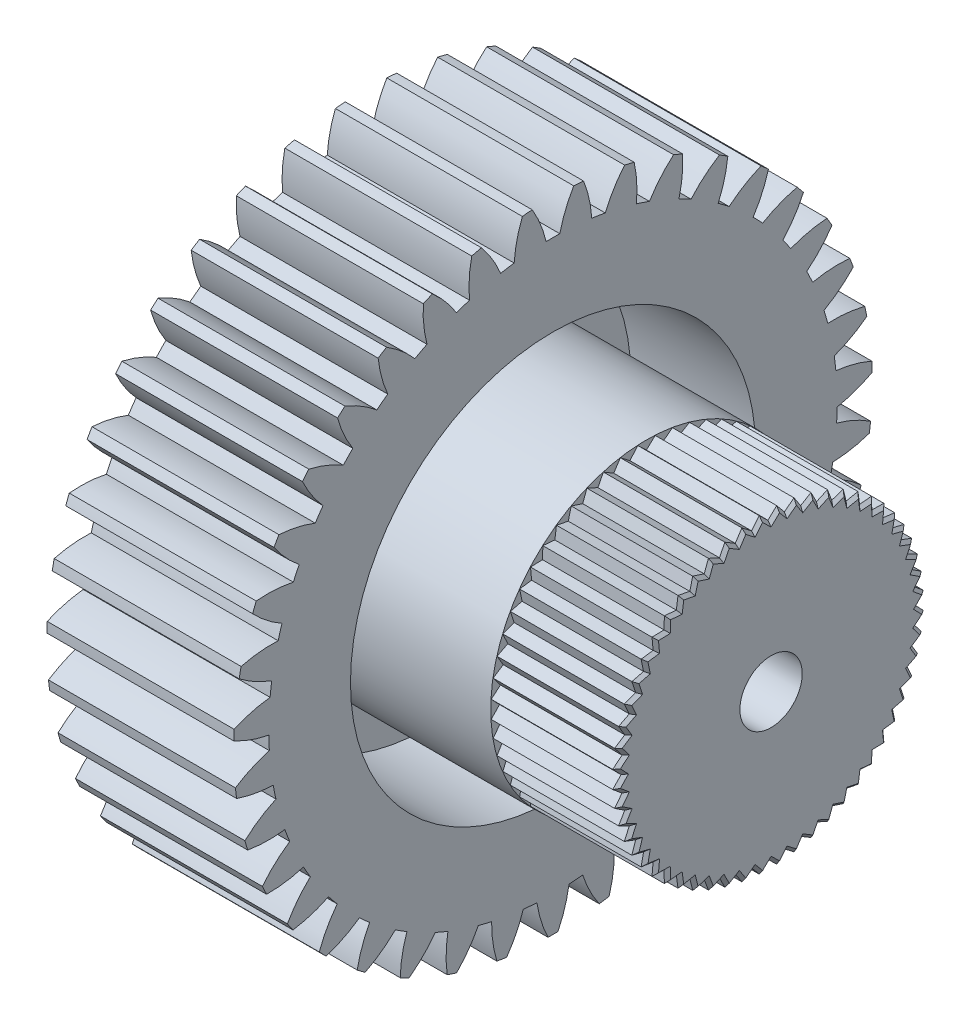
from build123d import *

# Parameters (mm, degrees)
CUT_EXTRUDE1_START         = -3
CUT_EXTRUDE1_OUTLINE_R     = 3.25
CUT_EXTRUDE1_DEPTH         = 3
CUT_EXTRUDE1_2_OUTLINE_R   = 3.25
CUT_EXTRUDE1_2_OUTLINE_R_2 = 0.5
CUT_EXTRUDE1_2_DEPTH       = 1
BOSS_EXTRUDE1_DEPTH        = 3.5
BOSS_EXTRUDE1_DEPTH_BACK   = 2
SKETCH1_3_R                = 2.5
CUT_EXTRUDE2_START         = -2
CUT_EXTRUDE2_DEPTH         = 12.734739324
CIRPATTERN1_COUNT          = 56
CHAMFER1_SIZE              = 0.05
SKETCH3_R                  = 0.5
CUT_EXTRUDE3_DEPTH         = 10.097535364


with BuildPart() as part:
    # Cut-Extrude1: read off the stored shape, not the designer's step
    # Cut-Extrude1 outline → Cut-Extrude1 (new body)
    with BuildSketch(Plane(origin=(3, 0, 0), x_dir=(0, 0, -1), z_dir=(1, 0, 0)).offset(CUT_EXTRUDE1_START)):
        with BuildLine():
            ThreePointArc((-5.117025453, 0.285789287), (-5.120843616, 0.206362943), (-5.123428999, 0.12688692))
            ThreePointArc((-5.123428999, 0.12688692), (-4.849895818, 0.0048664), (-4.560902559, -0.073824801))
            ThreePointArc((-4.560902559, -0.073824801), (-4.557800615, -0.183673086), (-4.552053385, -0.293414769))
            ThreePointArc((-4.552053385, -0.293414769), (-4.833777518, -0.395105094), (-5.096605143, -0.538740217))
            ThreePointArc((-5.096605143, -0.538740217), (-5.08763298, -0.617750486), (-5.077436033, -0.69661204))
            ThreePointArc((-5.077436033, -0.69661204), (-4.787871566, -0.773174619), (-4.489997737, -0.804489011))
            ThreePointArc((-4.489997737, -0.804489011), (-4.469315059, -0.912417202), (-4.446038451, -1.019815839))
            ThreePointArc((-4.446038451, -1.019815839), (-4.707802054, -1.16538103), (-4.944185436, -1.349316631))
            ThreePointArc((-4.944185436, -1.349316631), (-4.922655322, -1.425864503), (-4.89994014, -1.502069115))
            ThreePointArc((-4.89994014, -1.502069115), (-4.601843956, -1.531190821), (-4.302804333, -1.514317378))
            ThreePointArc((-4.302804333, -1.514317378), (-4.265076591, -1.617530192), (-4.224873456, -1.719804214))
            ThreePointArc((-4.224873456, -1.719804214), (-4.45989699, -1.905474209), (-4.663713924, -2.124946454))
            ThreePointArc((-4.663713924, -2.124946454), (-4.630183477, -2.197049377), (-4.595538371, -2.268623388))
            ThreePointArc((-4.595538371, -2.268623388), (-4.296631004, -2.249549986), (-4.004170557, -2.18492572))
            ThreePointArc((-4.004170557, -2.18492572), (-3.950374879, -2.28075), (-3.894286457, -2.375250564))
            ThreePointArc((-3.894286457, -2.375250564), (-4.096482937, -2.596216607), (-4.262454672, -2.845541279))
            ThreePointArc((-4.262454672, -2.845541279), (-4.217792313, -2.911331827), (-4.172114573, -2.976421508))
            ThreePointArc((-4.172114573, -2.976421508), (-3.880137567, -2.909646987), (-3.601830867, -2.798945633))
            ThreePointArc((-3.601830867, -2.798945633), (-3.533360533, -2.88489958), (-3.462839485, -2.969179171))
            ThreePointArc((-3.462839485, -2.969179171), (-3.626972127, -3.219718359), (-3.750800082, -3.492438081))
            ThreePointArc((-3.750800082, -3.492438081), (-3.696162543, -3.550212312), (-3.640635198, -3.607131873))
            ThreePointArc((-3.640635198, -3.607131873), (-3.363150604, -3.49438566), (-3.106205649, -3.340474325))
            ThreePointArc((-3.106205649, -3.340474325), (-3.024834006, -3.414331778), (-2.941706789, -3.486207598))
            ThreePointArc((-2.941706789, -3.486207598), (-3.063524645, -3.759831096), (-3.14200174, -4.04888257))
            ThreePointArc((-3.14200174, -4.04888257), (-3.078804104, -4.097144162), (-3.014865285, -4.144419418))
            ThreePointArc((-3.014865285, -4.144419418), (-2.759059808, -3.988621579), (-2.530131336, -3.795486487))
            ThreePointArc((-2.530131336, -3.795486487), (-2.437965866, -3.855334575), (-2.344385433, -3.912945079))
            ThreePointArc((-2.344385433, -3.912945079), (-2.420733483, -4.202566184), (-2.451827203, -4.500463128))
            ThreePointArc((-2.451827203, -4.500463128), (-2.381706256, -4.537962131), (-2.311011944, -4.574368677))
            ThreePointArc((-2.311011944, -4.574368677), (-2.083510811, -4.379554295), (-1.888527951, -4.152197542))
            ThreePointArc((-1.888527951, -4.152197542), (-1.787955691, -4.196486232), (-1.686345725, -4.238339338))
            ThreePointArc((-1.686345725, -4.238339338), (-1.715246596, -4.536457014), (-1.69815163, -4.835484054))
            ThreePointArc((-1.69815163, -4.835484054), (-1.622923468, -4.861249265), (-1.547304608, -4.88584419))
            ThreePointArc((-1.547304608, -4.88584419), (-1.35399998, -4.657058855), (-1.198012684, -4.401368862))
            ThreePointArc((-1.198012684, -4.401368862), (-1.091638403, -4.4289511), (-0.984630549, -4.453962835))
            ThreePointArc((-0.984630549, -4.453962835), (-0.965335723, -4.752855991), (-0.900494822, -5.045268484))
            ThreePointArc((-0.900494822, -5.045268484), (-0.822107815, -5.058632596), (-0.743522895, -5.070778905))
            ThreePointArc((-0.743522895, -5.070778905), (-0.589421259, -4.813948037), (-0.476469518, -4.53654704))
            ThreePointArc((-0.476469518, -4.53654704), (-0.367048253, -4.546708461), (-0.257413959, -4.554231033))
            ThreePointArc((-0.257413959, -4.554231033), (-0.190423162, -4.846158493), (-0.079515671, -5.12438311))
            ThreePointArc((-0.079515671, -5.12438311), (0, -5.125), (0.079515671, -5.12438311))
            ThreePointArc((0.079515671, -5.12438311), (0.190423162, -4.846158493), (0.257413959, -4.554231033))
            ThreePointArc((0.257413959, -4.554231033), (0.367048253, -4.546708461), (0.476469518, -4.53654704))
            ThreePointArc((0.476469518, -4.53654704), (0.589421259, -4.813948037), (0.743522895, -5.070778905))
            ThreePointArc((0.743522895, -5.070778905), (0.822107815, -5.058632596), (0.900494822, -5.045268484))
            ThreePointArc((0.900494822, -5.045268484), (0.965335723, -4.752855991), (0.984630549, -4.453962835))
            ThreePointArc((0.984630549, -4.453962835), (1.091638403, -4.4289511), (1.198012684, -4.401368862))
            ThreePointArc((1.198012684, -4.401368862), (1.35399998, -4.657058855), (1.547304608, -4.88584419))
            ThreePointArc((1.547304608, -4.88584419), (1.622923468, -4.861249265), (1.69815163, -4.835484054))
            ThreePointArc((1.69815163, -4.835484054), (1.715246596, -4.536457014), (1.686345725, -4.238339338))
            ThreePointArc((1.686345725, -4.238339338), (1.787955691, -4.196486232), (1.888527951, -4.152197542))
            ThreePointArc((1.888527951, -4.152197542), (2.083510811, -4.379554295), (2.311011944, -4.574368677))
            ThreePointArc((2.311011944, -4.574368677), (2.381706256, -4.537962131), (2.451827203, -4.500463128))
            ThreePointArc((2.451827203, -4.500463128), (2.420733483, -4.202566184), (2.344385433, -3.912945079))
            ThreePointArc((2.344385433, -3.912945079), (2.437965866, -3.855334575), (2.530131336, -3.795486487))
            ThreePointArc((2.530131336, -3.795486487), (2.759059808, -3.988621579), (3.014865285, -4.144419418))
            ThreePointArc((3.014865285, -4.144419418), (3.078804104, -4.097144162), (3.14200174, -4.04888257))
            ThreePointArc((3.14200174, -4.04888257), (3.063524645, -3.759831096), (2.941706789, -3.486207598))
            ThreePointArc((2.941706789, -3.486207598), (3.024834006, -3.414331778), (3.106205649, -3.340474325))
            ThreePointArc((3.106205649, -3.340474325), (3.363150604, -3.49438566), (3.640635198, -3.607131873))
            ThreePointArc((3.640635198, -3.607131873), (3.696162543, -3.550212312), (3.750800082, -3.492438081))
            ThreePointArc((3.750800082, -3.492438081), (3.626972127, -3.219718359), (3.462839485, -2.969179171))
            ThreePointArc((3.462839485, -2.969179171), (3.533360533, -2.88489958), (3.601830867, -2.798945633))
            ThreePointArc((3.601830867, -2.798945633), (3.880137567, -2.909646987), (4.172114573, -2.976421508))
            ThreePointArc((4.172114573, -2.976421508), (4.217792313, -2.911331827), (4.262454672, -2.845541279))
            ThreePointArc((4.262454672, -2.845541279), (4.096482937, -2.596216607), (3.894286457, -2.375250564))
            ThreePointArc((3.894286457, -2.375250564), (3.950374879, -2.28075), (4.004170557, -2.18492572))
            ThreePointArc((4.004170557, -2.18492572), (4.296631004, -2.249549986), (4.595538371, -2.268623388))
            ThreePointArc((4.595538371, -2.268623388), (4.630183477, -2.197049377), (4.663713924, -2.124946454))
            ThreePointArc((4.663713924, -2.124946454), (4.45989699, -1.905474209), (4.224873456, -1.719804214))
            ThreePointArc((4.224873456, -1.719804214), (4.265076591, -1.617530192), (4.302804333, -1.514317378))
            ThreePointArc((4.302804333, -1.514317378), (4.601843956, -1.531190821), (4.89994014, -1.502069115))
            ThreePointArc((4.89994014, -1.502069115), (4.922655322, -1.425864503), (4.944185436, -1.349316631))
            ThreePointArc((4.944185436, -1.349316631), (4.707802054, -1.16538103), (4.446038451, -1.019815839))
            ThreePointArc((4.446038451, -1.019815839), (4.469315059, -0.912417202), (4.489997737, -0.804489011))
            ThreePointArc((4.489997737, -0.804489011), (4.787871566, -0.773174619), (5.077436033, -0.69661204))
            ThreePointArc((5.077436033, -0.69661204), (5.08763298, -0.617750486), (5.096605143, -0.538740217))
            ThreePointArc((5.096605143, -0.538740217), (4.833777518, -0.395105094), (4.552053385, -0.293414769))
            ThreePointArc((4.552053385, -0.293414769), (4.557800615, -0.183673086), (4.560902559, -0.073824801))
            ThreePointArc((4.560902559, -0.073824801), (4.849895818, 0.0048664), (5.123428999, 0.12688692))
            ThreePointArc((5.123428999, 0.12688692), (5.120843616, 0.206362943), (5.117025453, 0.285789287))
            ThreePointArc((5.117025453, 0.285789287), (4.834560682, 0.385403856), (4.540172528, 0.440585589))
            ThreePointArc((4.540172528, 0.440585589), (4.528241529, 0.549828067), (4.513682399, 0.658751432))
            ThreePointArc((4.513682399, 0.658751432), (4.786310315, 0.782781381), (5.036727846, 0.947099576))
            ThreePointArc((5.036727846, 0.947099576), (5.021427092, 1.025131681), (5.004917491, 1.102916998))
            ThreePointArc((5.004917491, 1.102916998), (4.710131265, 1.155931048), (4.410703588, 1.163175012))
            ThreePointArc((4.410703588, 1.163175012), (4.381403366, 1.269088962), (4.349560237, 1.374266349))
            ThreePointArc((4.349560237, 1.374266349), (4.59876189, 1.540422736), (4.819578087, 1.74278285))
            ThreePointArc((4.819578087, 1.74278285), (4.791958244, 1.817350046), (4.763184796, 1.891479738))
            ThreePointArc((4.763184796, 1.891479738), (4.463711922, 1.896520234), (4.166999741, 1.855638814))
            ThreePointArc((4.166999741, 1.855638814), (4.121089157, 1.955481119), (4.072786749, 2.054188489))
            ThreePointArc((4.072786749, 2.054188489), (4.292107947, 2.258167951), (4.477603787, 2.493328964))
            ThreePointArc((4.477603787, 2.493328964), (4.438380194, 2.5625), (4.398088117, 2.631054146))
            ThreePointArc((4.398088117, 2.631054146), (4.101684785, 2.587990542), (3.81537279, 2.500042544))
            ThreePointArc((3.81537279, 2.500042544), (3.754040904, 2.591227342), (3.690530223, 2.680908227))
            ThreePointArc((3.690530223, 2.680908227), (3.874290663, 2.917427803), (4.019661902, 3.179299168))
            ThreePointArc((4.019661902, 3.179299168), (3.969850429, 3.24128255), (3.919083265, 3.302485634))
            ThreePointArc((3.919083265, 3.302485634), (3.633426167, 3.212433254), (3.364929688, 3.079696486))
            ThreePointArc((3.364929688, 3.079696486), (3.289764964, 3.159862139), (3.212690904, 3.23819385))
            ThreePointArc((3.212690904, 3.23819385), (3.356131286, 3.501127807), (3.457612884, 3.782927193))
            ThreePointArc((3.457612884, 3.782927193), (3.398503623, 3.836117584), (3.338576216, 3.888384478))
            ThreePointArc((3.338576216, 3.888384478), (3.071063719, 3.753675633), (2.827336674, 3.579587907))
            ThreePointArc((2.827336674, 3.579587907), (2.740285838, 3.646658165), (2.651644577, 3.711611952))
            ThreePointArc((2.651644577, 3.711611952), (2.751049871, 3.994150439), (2.806013509, 4.28857939))
            ThreePointArc((2.806013509, 4.28857939), (2.739137359, 4.331599188), (2.671601796, 4.373576208))
            ThreePointArc((2.671601796, 4.373576208), (2.429162335, 4.197699784), (2.216517126, 3.986769881))
            ThreePointArc((2.216517126, 3.986769881), (2.119834749, 4.039007661), (2.021922049, 4.088901256))
            ThreePointArc((2.021922049, 4.088901256), (2.07471771, 4.383726674), (2.081739858, 4.683159635))
            ThreePointArc((2.081739858, 4.683159635), (2.008828876, 4.714894649), (1.935434293, 4.745494611))
            ThreePointArc((1.935434293, 4.745494611), (1.724346921, 4.533005716), (1.548290948, 4.290696609))
            ThreePointArc((1.548290948, 4.290696609), (1.444481054, 4.32674898), (1.339832802, 4.360290164))
            ThreePointArc((1.339832802, 4.360290164), (1.34465145, 4.659766689), (1.303550238, 4.956448504))
            ThreePointArc((1.303550238, 4.956448504), (1.226492779, 4.976076814), (1.149140058, 4.994507196))
            ThreePointArc((1.149140058, 4.994507196), (0.974871828, 4.750909181), (0.839964848, 4.483496549))
            ThreePointArc((0.839964848, 4.483496549), (0.731716058, 4.502429773), (0.623042589, 4.518749847))
            ThreePointArc((0.623042589, 4.518749847), (0.579759423, 4.815121196), (0.491599352, 5.101367961))
            ThreePointArc((0.491599352, 5.101367961), (0.412391165, 5.108381204), (0.3330837, 5.114164668))
            ThreePointArc((0.3330837, 5.114164668), (0.200148067, 4.845766593), (0.1098841, 4.560176283))
            ThreePointArc((0.1098841, 4.560176283), (0, 4.5615), (-0.1098841, 4.560176283))
            ThreePointArc((-0.1098841, 4.560176283), (-0.200148067, 4.845766593), (-0.3330837, 5.114164668))
            ThreePointArc((-0.3330837, 5.114164668), (-0.412391165, 5.108381204), (-0.491599352, 5.101367961))
            ThreePointArc((-0.491599352, 5.101367961), (-0.579759423, 4.815121196), (-0.623042589, 4.518749847))
            ThreePointArc((-0.623042589, 4.518749847), (-0.731716058, 4.502429773), (-0.839964848, 4.483496549))
            ThreePointArc((-0.839964848, 4.483496549), (-0.974871828, 4.750909181), (-1.149140058, 4.994507196))
            ThreePointArc((-1.149140058, 4.994507196), (-1.226492779, 4.976076814), (-1.303550238, 4.956448504))
            ThreePointArc((-1.303550238, 4.956448504), (-1.34465145, 4.659766689), (-1.339832802, 4.360290164))
            ThreePointArc((-1.339832802, 4.360290164), (-1.444481054, 4.32674898), (-1.548290948, 4.290696609))
            ThreePointArc((-1.548290948, 4.290696609), (-1.724346921, 4.533005716), (-1.935434293, 4.745494611))
            ThreePointArc((-1.935434293, 4.745494611), (-2.008828876, 4.714894649), (-2.081739858, 4.683159635))
            ThreePointArc((-2.081739858, 4.683159635), (-2.07471771, 4.383726674), (-2.021922049, 4.088901256))
            ThreePointArc((-2.021922049, 4.088901256), (-2.119834749, 4.039007661), (-2.216517126, 3.986769881))
            ThreePointArc((-2.216517126, 3.986769881), (-2.429162335, 4.197699784), (-2.671601796, 4.373576208))
            ThreePointArc((-2.671601796, 4.373576208), (-2.739137359, 4.331599188), (-2.806013509, 4.28857939))
            ThreePointArc((-2.806013509, 4.28857939), (-2.751049871, 3.994150439), (-2.651644577, 3.711611952))
            ThreePointArc((-2.651644577, 3.711611952), (-2.740285838, 3.646658165), (-2.827336674, 3.579587907))
            ThreePointArc((-2.827336674, 3.579587907), (-3.071063719, 3.753675633), (-3.338576216, 3.888384478))
            ThreePointArc((-3.338576216, 3.888384478), (-3.398503623, 3.836117584), (-3.457612884, 3.782927193))
            ThreePointArc((-3.457612884, 3.782927193), (-3.356131286, 3.501127807), (-3.212690904, 3.23819385))
            ThreePointArc((-3.212690904, 3.23819385), (-3.289764964, 3.159862139), (-3.364929688, 3.079696486))
            ThreePointArc((-3.364929688, 3.079696486), (-3.633426167, 3.212433254), (-3.919083265, 3.302485634))
            ThreePointArc((-3.919083265, 3.302485634), (-3.969850429, 3.24128255), (-4.019661902, 3.179299168))
            ThreePointArc((-4.019661902, 3.179299168), (-3.874290663, 2.917427803), (-3.690530223, 2.680908227))
            ThreePointArc((-3.690530223, 2.680908227), (-3.754040904, 2.591227342), (-3.81537279, 2.500042544))
            ThreePointArc((-3.81537279, 2.500042544), (-4.101684785, 2.587990542), (-4.398088117, 2.631054146))
            ThreePointArc((-4.398088117, 2.631054146), (-4.438380194, 2.5625), (-4.477603787, 2.493328964))
            ThreePointArc((-4.477603787, 2.493328964), (-4.292107947, 2.258167951), (-4.072786749, 2.054188489))
            ThreePointArc((-4.072786749, 2.054188489), (-4.121089157, 1.955481119), (-4.166999741, 1.855638814))
            ThreePointArc((-4.166999741, 1.855638814), (-4.463711922, 1.896520234), (-4.763184796, 1.891479738))
            ThreePointArc((-4.763184796, 1.891479738), (-4.791958244, 1.817350046), (-4.819578087, 1.74278285))
            ThreePointArc((-4.819578087, 1.74278285), (-4.59876189, 1.540422736), (-4.349560237, 1.374266349))
            ThreePointArc((-4.349560237, 1.374266349), (-4.381403366, 1.269088962), (-4.410703588, 1.163175012))
            ThreePointArc((-4.410703588, 1.163175012), (-4.710131265, 1.155931048), (-5.004917491, 1.102916998))
            ThreePointArc((-5.004917491, 1.102916998), (-5.021427092, 1.025131681), (-5.036727846, 0.947099576))
            ThreePointArc((-5.036727846, 0.947099576), (-4.786310315, 0.782781381), (-4.513682399, 0.658751432))
            ThreePointArc((-4.513682399, 0.658751432), (-4.528241529, 0.549828067), (-4.540172528, 0.440585589))
            ThreePointArc((-4.540172528, 0.440585589), (-4.834560682, 0.385403856), (-5.117025453, 0.285789287))
        make_face()
        Circle(CUT_EXTRUDE1_OUTLINE_R, mode=Mode.SUBTRACT)
    extrude(amount=CUT_EXTRUDE1_DEPTH)

    # Cut-Extrude1 2 outline → Cut-Extrude1 2 (add)
    with BuildSketch(Plane(origin=(3, 0, 0), x_dir=(0, 0, -1), z_dir=(1, 0, 0)).offset(CUT_EXTRUDE1_START)):
        Circle(CUT_EXTRUDE1_2_OUTLINE_R)
        Circle(CUT_EXTRUDE1_2_OUTLINE_R_2, mode=Mode.SUBTRACT)
    extrude(amount=CUT_EXTRUDE1_2_DEPTH)

    # Sketch1<3> → Boss-Extrude1 (add, two sides: drawn at the far end of the back side and taken through both)
    with BuildSketch(Plane(origin=(3, 0, 0), x_dir=(0, 0, -1), z_dir=(1, 0, 0)).offset(-BOSS_EXTRUDE1_DEPTH_BACK)):
        Circle(SKETCH1_3_R)
    extrude(amount=BOSS_EXTRUDE1_DEPTH + BOSS_EXTRUDE1_DEPTH_BACK)

    # Sketch2 → Cut-Extrude2 (cut)
    with BuildSketch(Plane(origin=(6.5, 0, 0), x_dir=(0, 0, -1), z_dir=(1, 0, 0)).offset(CUT_EXTRUDE2_START)):
        Polygon((-20.746521126, 22.229939032), (-0.144431099, 2.495824444), (0, 2.357478293), (0.144431099, 2.495824444), (20.746521126, 22.229939032), (20.746521126, 79.287152145), (-20.746521126, 79.287152145), align=None)
    cut_extrude2 = extrude(amount=CUT_EXTRUDE2_DEPTH, mode=Mode.SUBTRACT)

    # CirPattern1: Cut-Extrude2 ×56 about axis
    cirpattern1_axis = Axis((-6.071067812, 0, 0), (1, 0, 0))
    for i in range(1, CIRPATTERN1_COUNT):
        add(cut_extrude2.rotate(cirpattern1_axis, i * 360 / CIRPATTERN1_COUNT), mode=Mode.SUBTRACT)

    # Chamfer1
    chamfer1_edges = [part.edges().sort_by_distance(p)[0] for p in [
        (6.5, 2.42449076, -0.06995991),
        (6.5, 2.401413047, -0.340976855),
        (6.5, 2.417079096, -0.201936821),
        (6.5, 2.348136171, -0.607705817),
        (6.5, 2.37927126, -0.471294079),
        (6.5, 2.26533012, -0.866792527),
        (6.5, 2.311542707, -0.734724541),
        (6.5, 2.154036228, -1.114978817),
        (6.5, 2.214745163, -0.988915416),
        (6.5, 2.015654081, -1.349143602),
        (6.5, 2.090095914, -1.230670105),
        (6.5, 1.851923915, -1.566342124),
        (6.5, 1.939162496, -1.456948404),
        (6.5, 1.664904731, -1.763842984),
        (6.5, 1.763842984, -1.664904731),
        (6.5, 1.456948404, -1.939162496),
        (6.5, 1.566342124, -1.851923915),
        (6.5, 1.230670105, -2.090095914),
        (6.5, 1.349143602, -2.015654081),
        (6.5, 0.988915416, -2.214745163),
        (6.5, 1.114978817, -2.154036228),
        (6.5, 0.734724541, -2.311542707),
        (6.5, 0.866792527, -2.26533012),
        (6.5, 0.471294079, -2.37927126),
        (6.5, 0.607705817, -2.348136171),
        (6.5, 0.201936821, -2.417079096),
        (6.5, 0.340976855, -2.401413047),
        (6.5, -0.06995991, -2.42449076),
        (6.5, 0.06995991, -2.42449076),
        (6.5, -0.340976855, -2.401413047),
        (6.5, -0.201936821, -2.417079096),
        (6.5, -0.607705817, -2.348136171),
        (6.5, -0.471294079, -2.37927126),
        (6.5, -0.866792527, -2.26533012),
        (6.5, -0.734724541, -2.311542707),
        (6.5, -1.114978817, -2.154036228),
        (6.5, -0.988915416, -2.214745163),
        (6.5, -1.349143602, -2.015654081),
        (6.5, -1.230670105, -2.090095914),
        (6.5, -1.566342124, -1.851923915),
        (6.5, -1.456948404, -1.939162496),
        (6.5, -1.763842984, -1.664904731),
        (6.5, -1.664904731, -1.763842984),
        (6.5, -1.939162496, -1.456948404),
        (6.5, -1.851923915, -1.566342124),
        (6.5, -2.090095914, -1.230670105),
        (6.5, -2.015654081, -1.349143602),
        (6.5, -2.214745163, -0.988915416),
        (6.5, -2.154036228, -1.114978817),
        (6.5, -2.311542707, -0.734724541),
        (6.5, -2.26533012, -0.866792527),
        (6.5, -2.37927126, -0.471294079),
        (6.5, -2.348136171, -0.607705817),
        (6.5, -2.417079096, -0.201936821),
        (6.5, -2.401413047, -0.340976855),
        (6.5, -2.42449076, 0.06995991),
        (6.5, -2.42449076, -0.06995991),
        (6.5, -2.401413047, 0.340976855),
        (6.5, -2.417079096, 0.201936821),
        (6.5, -2.348136171, 0.607705817),
        (6.5, -2.37927126, 0.471294079),
        (6.5, -2.26533012, 0.866792527),
        (6.5, -2.311542707, 0.734724541),
        (6.5, -2.154036228, 1.114978817),
        (6.5, -2.214745163, 0.988915416),
        (6.5, -2.015654081, 1.349143602),
        (6.5, -2.090095914, 1.230670105),
        (6.5, -1.851923915, 1.566342124),
        (6.5, -1.939162496, 1.456948404),
        (6.5, -1.664904731, 1.763842984),
        (6.5, -1.763842984, 1.664904731),
        (6.5, -1.456948404, 1.939162496),
        (6.5, -1.566342124, 1.851923915),
        (6.5, -1.230670105, 2.090095914),
        (6.5, -1.349143602, 2.015654081),
        (6.5, -0.988915416, 2.214745163),
        (6.5, -1.114978817, 2.154036228),
        (6.5, -0.734724541, 2.311542707),
        (6.5, -0.866792527, 2.26533012),
        (6.5, -0.471294079, 2.37927126),
        (6.5, -0.607705817, 2.348136171),
        (6.5, -0.201936821, 2.417079096),
        (6.5, -0.340976855, 2.401413047),
        (6.5, 0.06995991, 2.42449076),
        (6.5, -0.06995991, 2.42449076),
        (6.5, 0.340976855, 2.401413047),
        (6.5, 0.201936821, 2.417079096),
        (6.5, 0.607705817, 2.348136171),
        (6.5, 0.471294079, 2.37927126),
        (6.5, 0.866792527, 2.26533012),
        (6.5, 0.734724541, 2.311542707),
        (6.5, 1.114978817, 2.154036228),
        (6.5, 0.988915416, 2.214745163),
        (6.5, 1.349143602, 2.015654081),
        (6.5, 1.230670105, 2.090095914),
        (6.5, 1.566342124, 1.851923915),
        (6.5, 1.456948404, 1.939162496),
        (6.5, 1.763842984, 1.664904731),
        (6.5, 1.664904731, 1.763842984),
        (6.5, 1.939162496, 1.456948404),
        (6.5, 1.851923915, 1.566342124),
        (6.5, 2.090095914, 1.230670105),
        (6.5, 2.015654081, 1.349143602),
        (6.5, 2.214745163, 0.988915416),
        (6.5, 2.154036228, 1.114978817),
        (6.5, 2.311542707, 0.734724541),
        (6.5, 2.26533012, 0.866792527),
        (6.5, 2.37927126, 0.471294079),
        (6.5, 2.348136171, 0.607705817),
        (6.5, 2.42449076, 0.06995991),
        (6.5, 2.417079096, 0.201936821),
        (6.5, 2.401413047, 0.340976855),
    ]]
    chamfer(chamfer1_edges, length=CHAMFER1_SIZE)

    # Sketch3 → Cut-Extrude3 (cut, through all)
    with BuildSketch(Plane.ZY.offset(-1)):
        Circle(SKETCH3_R)
    extrude(amount=-CUT_EXTRUDE3_DEPTH, mode=Mode.SUBTRACT)


solid = part.part
